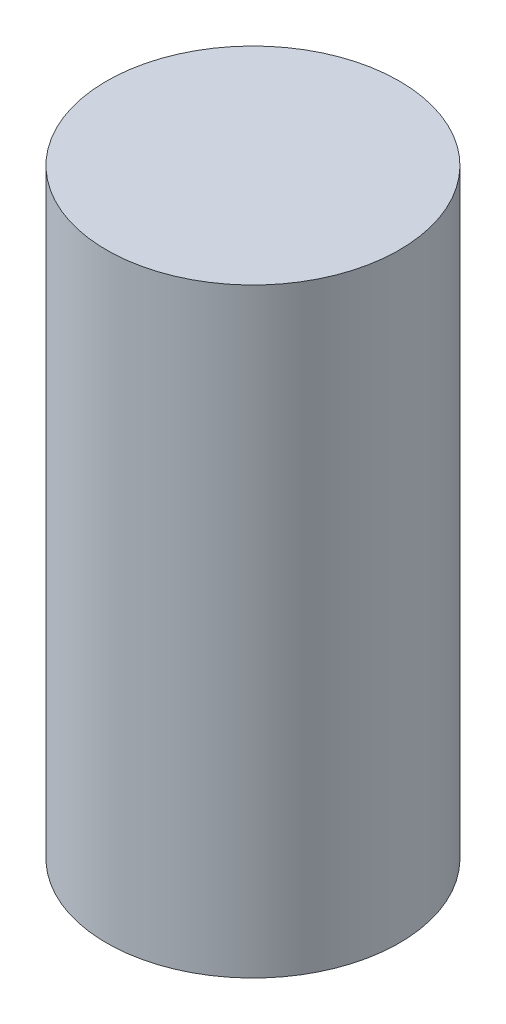
from build123d import *

# Parameters (mm, degrees)
SKETCH1_R           = 200
BOSS_EXTRUDE1_DEPTH = 820


with BuildPart() as part:
    # Sketch1 → Boss-Extrude1 (new body)
    with BuildSketch(Plane(origin=(0, 0, 0), x_dir=(1, 0, 0), z_dir=(0, 1, 0))):
        Circle(SKETCH1_R)
    extrude(amount=BOSS_EXTRUDE1_DEPTH)


solid = part.part
